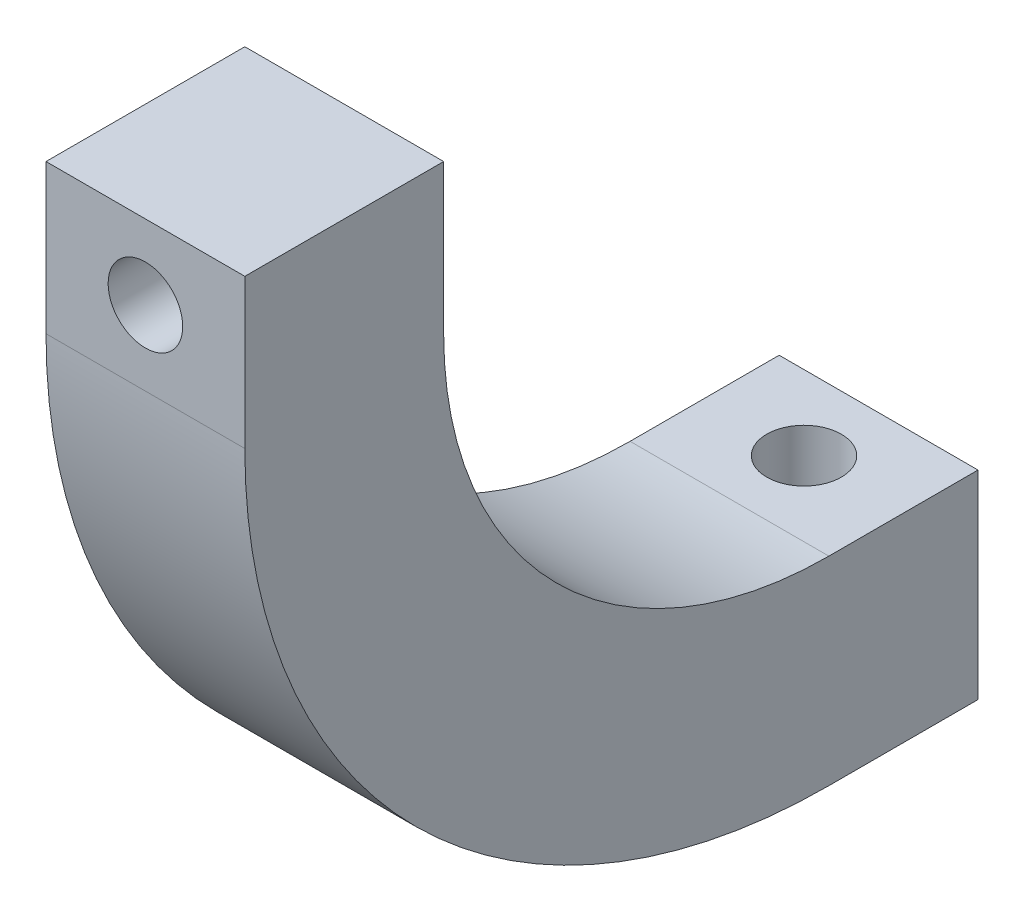
from build123d import *

# Parameters (mm, degrees)
BOSS_EXTRUDE1_DEPTH      = 4
BOSS_EXTRUDE1_DEPTH_BACK = 4
SKETCH7_R                = 1.5
CUT_EXTRUDE1_DEPTH       = 38.68952109
SKETCH8_R                = 1.5
CUT_EXTRUDE2_DEPTH       = 38.68952109


with BuildPart() as part:
    # Sketch5 → Boss-Extrude1 (new, two sides: drawn at the far end of the back side and taken through both)
    with BuildSketch(Plane(origin=(0, 0, 0), x_dir=(0, 0, -1), z_dir=(1, 0, 0)).offset(-BOSS_EXTRUDE1_DEPTH_BACK)):
        with BuildLine():
            Line((-18.5, 3), (-18.5, 0))
            Line((-18.5, 0), (-18.5, -3))
            ThreePointArc((-18.5, -3), (-13.960155108, -13.960155108), (-3, -18.5))
            Line((-3, -18.5), (0, -18.5))
            Line((0, -18.5), (3, -18.5))
            Line((3, -18.5), (3, -26.5))
            Line((3, -26.5), (-3, -26.5))
            ThreePointArc((-3, -26.5), (-19.617009358, -19.617009358), (-26.5, -3))
            Line((-26.5, -3), (-26.5, 3))
            Line((-26.5, 3), (-18.5, 3))
        make_face()
    extrude(amount=BOSS_EXTRUDE1_DEPTH + BOSS_EXTRUDE1_DEPTH_BACK)

    # Sketch7 → Cut-Extrude1 (cut, through all)
    with BuildSketch(Plane.XY):
        Circle(SKETCH7_R)
    extrude(amount=CUT_EXTRUDE1_DEPTH, mode=Mode.SUBTRACT)

    # Sketch8 → Cut-Extrude2 (cut, through all)
    with BuildSketch(Plane(origin=(0, 0, 0), x_dir=(1, 0, 0), z_dir=(0, 1, 0))):
        Circle(SKETCH8_R)
    extrude(amount=-CUT_EXTRUDE2_DEPTH, mode=Mode.SUBTRACT)


solid = part.part
